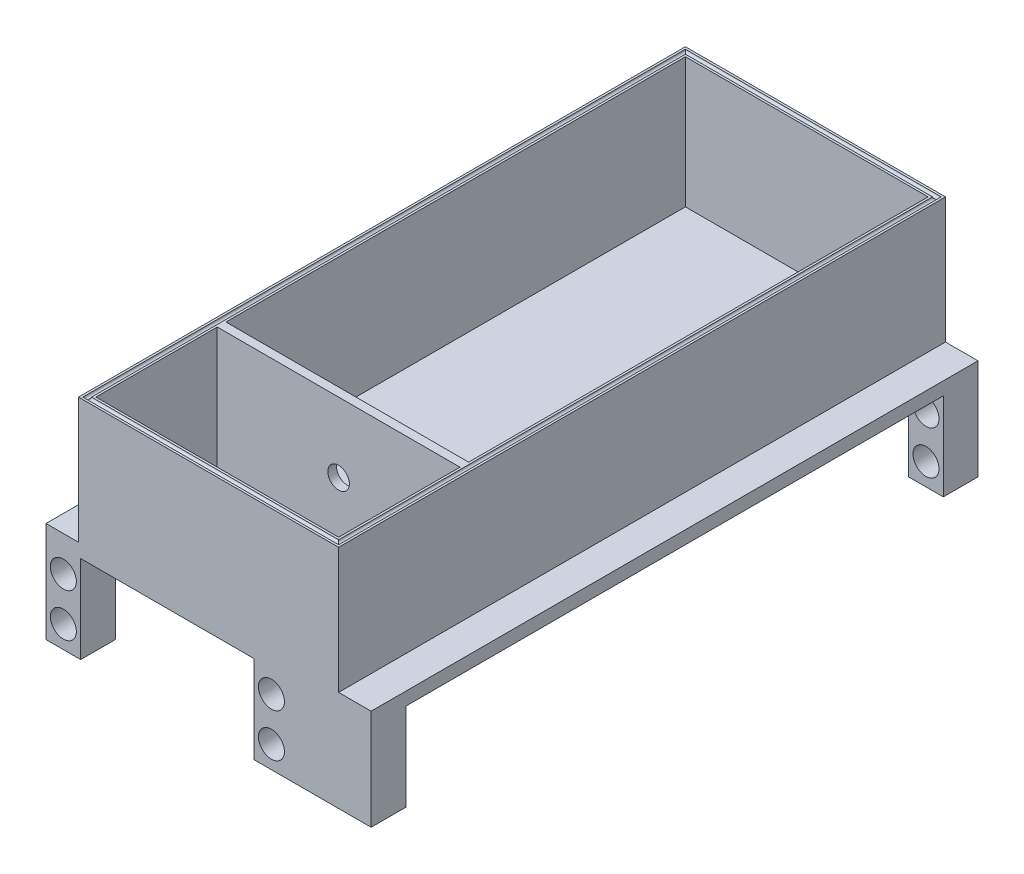
from build123d import *

# Parameters (mm, degrees)
SKETCH1_W            = 60
SKETCH1_H            = 110
BOSS_EXTRUDE1_DEPTH  = 2
SKETCH2_W            = 60
SKETCH2_H            = 110
SKETCH2_W_2          = 56
SKETCH2_H_2          = 106
BOSS_EXTRUDE2_DEPTH  = 30
SKETCH3_W            = 60
SKETCH3_H            = 30
BOSS_EXTRUDE3_DEPTH  = 2
BOSS_EXTRUDE4_DEPTH  = 30
SKETCH5_R            = 2.486759959
CUT_EXTRUDE1_DEPTH   = 30
CUT_SWEEP1_PROFILE_R = 0.5
SKETCH43_W           = 7.5
SKETCH43_H           = 140
BOSS_EXTRUDE7_DEPTH  = 3
SKETCH55_W           = 8
SKETCH55_H           = 8
SKETCH55_W_2         = 27
BOSS_EXTRUDE10_DEPTH = 20.2
SKETCH56_R           = 3
CUT_EXTRUDE3_DEPTH   = 20.2
SKETCH59_R           = 3
CUT_EXTRUDE4_DEPTH   = 20.2


with BuildPart() as part:
    # Sketch1 → Boss-Extrude1 (new body)
    with BuildSketch(Plane(origin=(0, 0, 0), x_dir=(1, 0, 0), z_dir=(0, 1, 0))):
        Rectangle(SKETCH1_W, SKETCH1_H)
    extrude(amount=BOSS_EXTRUDE1_DEPTH)

    # Sketch2 → Boss-Extrude2 (add)
    with BuildSketch(Plane(origin=(0, 2, 0), x_dir=(1, 0, 0), z_dir=(0, 1, 0))):
        Rectangle(SKETCH2_W, SKETCH2_H)
        Rectangle(SKETCH2_W_2, SKETCH2_H_2, mode=Mode.SUBTRACT)
    extrude(amount=BOSS_EXTRUDE2_DEPTH)

    # Sketch3 → Boss-Extrude3 (add)
    with BuildSketch(Plane(origin=(0, 0, 0), x_dir=(1, 0, 0), z_dir=(0, 1, 0))):
        with Locations((0, -70)):
            Rectangle(SKETCH3_W, SKETCH3_H)
    extrude(amount=BOSS_EXTRUDE3_DEPTH)

    # Sketch4 → Boss-Extrude4 (add)
    with BuildSketch(Plane(origin=(0, 2, 0), x_dir=(1, 0, 0), z_dir=(0, 1, 0))):
        Polygon((-28, -55), (-30, -55), (-30, -85), (30, -85), (30, -55), (28, -55), (28, -83), (-28, -83), align=None)
    extrude(amount=BOSS_EXTRUDE4_DEPTH)

    # Sketch5 → Cut-Extrude1 (cut)
    with BuildSketch(Plane.XY.offset(55)):
        with Locations((0, 15.890944925)):
            Circle(SKETCH5_R)
    extrude(amount=-CUT_EXTRUDE1_DEPTH, mode=Mode.SUBTRACT)

    # Cut-Sweep1: sweep along a path in Sketch6
    with BuildLine(Plane(origin=(0, 32, 0), x_dir=(1, 0, 0), z_dir=(0, 1, 0))) as cut_sweep1_path:
        Line((-29, 54), (-29, -84))
        Line((-29, -84), (29, -84))
        Line((29, -84), (29, 54))
        Line((29, 54), (-29, 54))
    # Cut-Sweep1 profile (on start of the path) → Cut-Sweep1 (sweep, cut)
    with BuildSketch(Plane(origin=(-29, 32, -54), x_dir=(1, 0, 0), z_dir=(0, 0, 1))):
        Circle(CUT_SWEEP1_PROFILE_R)
    sweep(path=cut_sweep1_path.line, transition=Transition.RIGHT, mode=Mode.SUBTRACT)

    # Sketch43 → Boss-Extrude7 (add)
    with BuildSketch(Plane.XZ):
        with Locations((33.75, 15)):
            Rectangle(SKETCH43_W, SKETCH43_H)
        Polygon((-30, -55), (-37.5, -55), (-37.5, 85), (-30, 85), (-30, 55), align=None)
    extrude(amount=-BOSS_EXTRUDE7_DEPTH)

    # Sketch55 → Boss-Extrude10 (add)
    with BuildSketch(Plane.XZ):
        with Locations((-33.5, 81)):
            Rectangle(SKETCH55_W, SKETCH55_H)
        with Locations((24, 81)):
            Rectangle(SKETCH55_W_2, SKETCH55_H)
        with Locations((33.5, -51)):
            Rectangle(SKETCH55_W, SKETCH55_H)
        with Locations((-24, -51)):
            Rectangle(SKETCH55_W_2, SKETCH55_H)
    extrude(amount=BOSS_EXTRUDE10_DEPTH)

    # Sketch56 → Cut-Extrude3 (cut)
    with BuildSketch(Plane.XY.offset(85)):
        with Locations((-33.5, -15.1)):
            Circle(SKETCH56_R)
        with Locations((-33.5, -5.1)):
            Circle(SKETCH56_R)
        with Locations((14.5, -15.1)):
            Circle(SKETCH56_R)
        with Locations((14.5, -5.1)):
            Circle(SKETCH56_R)
    extrude(amount=-CUT_EXTRUDE3_DEPTH, mode=Mode.SUBTRACT)

    # Sketch59 → Cut-Extrude4 (cut)
    with BuildSketch(Plane(origin=(0, 0, -55), x_dir=(-1, 0, 0), z_dir=(0, 0, -1))):
        with Locations((-33.5, -15.1)):
            Circle(SKETCH59_R)
        with Locations((-33.5, -5.1)):
            Circle(SKETCH59_R)
        with Locations((14.5, -5.1)):
            Circle(SKETCH59_R)
        with Locations((14.5, -15.1)):
            Circle(SKETCH59_R)
    extrude(amount=-CUT_EXTRUDE4_DEPTH, mode=Mode.SUBTRACT)


solid = part.part
